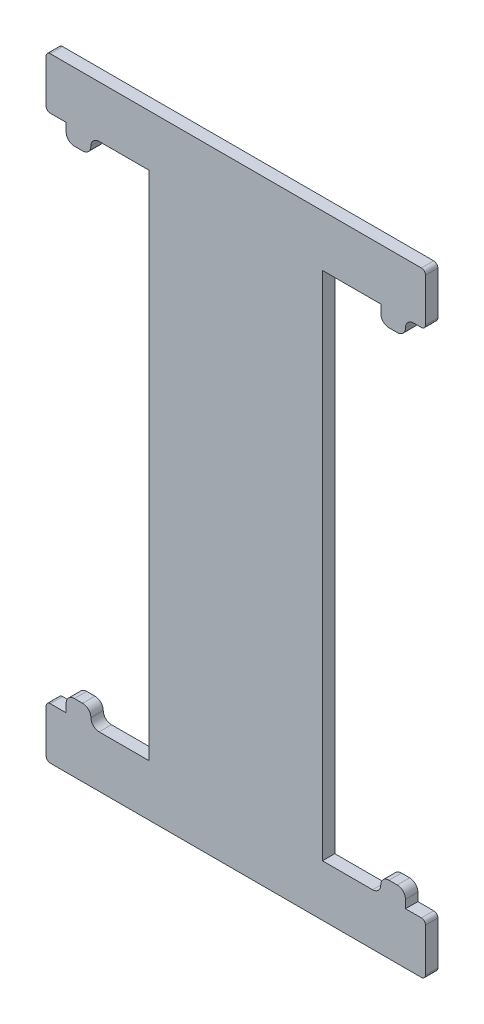
from build123d import *

# Parameters (mm, degrees)
SKETCH_1_W      = 42
SKETCH_1_H      = 149
EXTRUDE_1_DEPTH = 3
SKETCH_2_W      = 25
SKETCH_2_H      = 12.5
EXTRUDE_2_DEPTH = 3
FILLET_1_R      = 1
SKETCH_3_W      = 6
SKETCH_3_H      = 4
EXTRUDE_3_DEPTH = 3
FILLET_2_R      = 2


with BuildPart() as part:
    # 草图1 → 凸台-拉伸1 (new body)
    with BuildSketch(Plane.XY):
        Rectangle(SKETCH_1_W, SKETCH_1_H)
    extrude(amount=EXTRUDE_1_DEPTH)

    # 草图2 → 凸台-拉伸2 (add)
    with BuildSketch(Plane.XY.offset(3)):
        with Locations((33.5, -68.25)):
            Rectangle(SKETCH_2_W, SKETCH_2_H)
        with Locations((-33.5, -68.25)):
            Rectangle(SKETCH_2_W, SKETCH_2_H)
        with Locations((-33.5, 68.25)):
            Rectangle(SKETCH_2_W, SKETCH_2_H)
        with Locations((33.5, 68.25)):
            Rectangle(SKETCH_2_W, SKETCH_2_H)
    extrude(amount=-EXTRUDE_2_DEPTH)

    # 圆角1
    fillet_1_edges = [part.edges().sort_by_distance(p)[0] for p in [
        (46, -74.5, 1.5),
        (46, -62, 1.5),
        (-46, -62, 1.5),
        (-46, -74.5, 1.5),
        (-46, 74.5, 1.5),
        (-46, 62, 1.5),
        (46, 62, 1.5),
        (46, 74.5, 1.5),
    ]]
    fillet(fillet_1_edges, radius=FILLET_1_R)

    # 草图3 → 凸台-拉伸3 (add)
    with BuildSketch(Plane(origin=(0, 0, 0), x_dir=(-1, 0, 0), z_dir=(0, 0, -1))):
        with Locations((38.15, 60)):
            Rectangle(SKETCH_3_W, SKETCH_3_H)
        with Locations((-38.15, 60)):
            Rectangle(SKETCH_3_W, SKETCH_3_H)
        with Locations((-38.15, -60)):
            Rectangle(SKETCH_3_W, SKETCH_3_H)
        with Locations((38.15, -60)):
            Rectangle(SKETCH_3_W, SKETCH_3_H)
    extrude(amount=-EXTRUDE_3_DEPTH)

    # 圆角2
    fillet_2_edges = [part.edges().sort_by_distance(p)[0] for p in [
        (-41.15, -58, 1.5),
        (-35.15, -58, 1.5),
        (-35.15, -62, 1.5),
        (41.15, -58, 1.5),
        (35.15, -62, 1.5),
        (35.15, -58, 1.5),
        (35.15, 58, 1.5),
        (41.15, 58, 1.5),
        (-35.15, 58, 1.5),
        (-35.15, 62, 1.5),
        (-41.15, 58, 1.5),
        (41.15, 62, 1.5),
    ]]
    fillet(fillet_2_edges, radius=FILLET_2_R - 0.0001)  # a hair under: the kernel refuses the full size


solid = part.part
